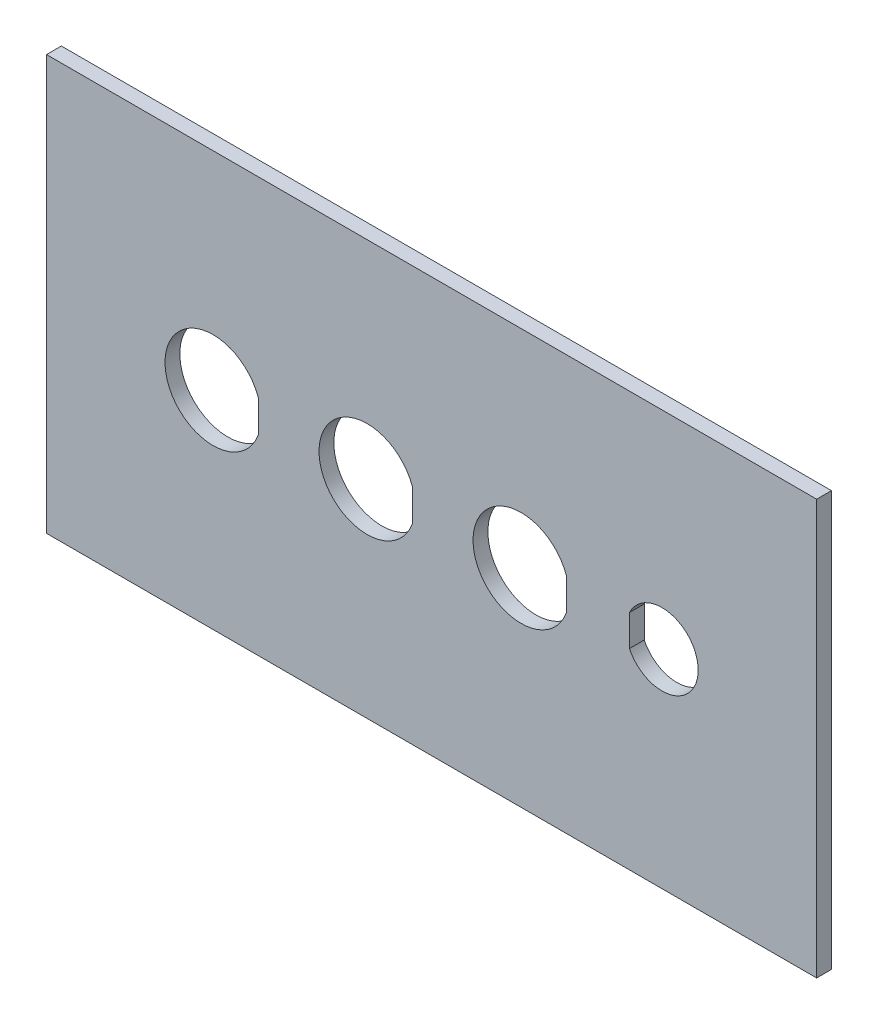
from build123d import *

# Parameters (mm, degrees)
SKETCH1_W           = 165.1
SKETCH1_H           = 88.9
BOSS_EXTRUDE1_DEPTH = 3.175


with BuildPart() as part:
    # Sketch1 → Boss-Extrude1 (new body)
    with BuildSketch(Plane.XY):
        with Locations((9.351172696, -0.493343457)):
            Rectangle(SKETCH1_W, SKETCH1_H)
        with BuildLine():
            Line((51.769172696, 2.857146657), (51.769172696, -3.84383357))
            ThreePointArc((51.769172696, -3.84383357), (66.501172696, -0.493343457), (51.769172696, 2.857146657))
        make_face(mode=Mode.SUBTRACT)
        with BuildLine():
            Line((-27.798827304, 2.970758158), (-27.798827304, -3.957445072))
            ThreePointArc((-27.798827304, -3.957445072), (-47.798827304, -0.493343457), (-27.798827304, 2.970758158))
        make_face(mode=Mode.SUBTRACT)
        with BuildLine():
            Line((5.221172696, 2.970758158), (5.221172696, -3.957445072))
            ThreePointArc((5.221172696, -3.957445072), (-14.778827304, -0.493343457), (5.221172696, 2.970758158))
        make_face(mode=Mode.SUBTRACT)
        with BuildLine():
            Line((38.241172696, 2.970758158), (38.241172696, -3.957445072))
            ThreePointArc((38.241172696, -3.957445072), (18.241172696, -0.493343457), (38.241172696, 2.970758158))
        make_face(mode=Mode.SUBTRACT)
    extrude(amount=BOSS_EXTRUDE1_DEPTH)


solid = part.part
